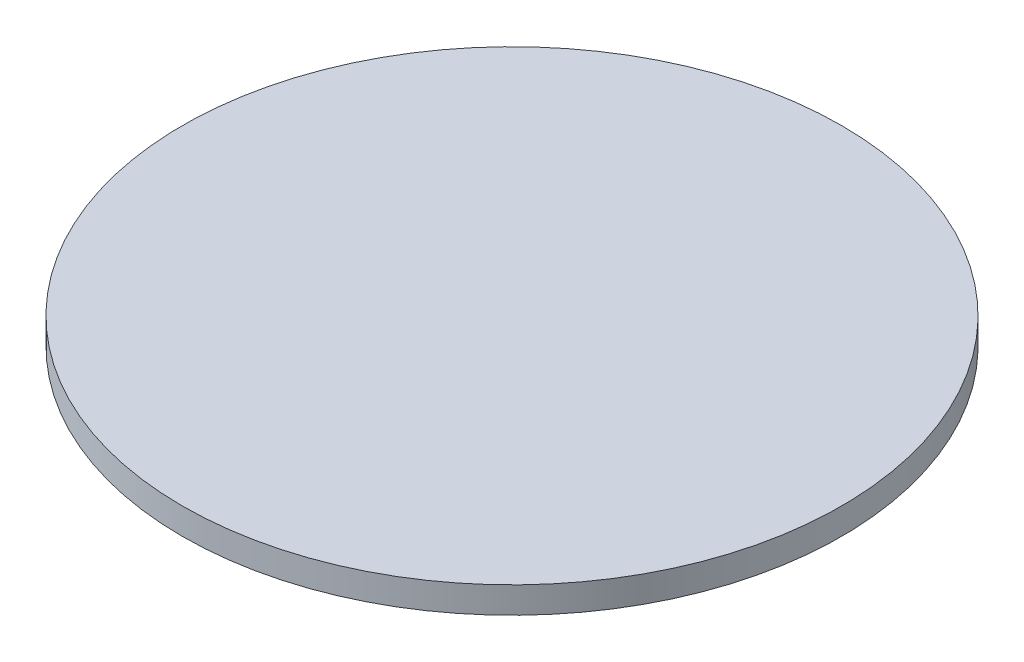
from build123d import *

# Parameters (mm, degrees)
SKETCH1_R           = 12.5
BOSS_EXTRUDE1_DEPTH = 1


with BuildPart() as part:
    # Sketch1 → Boss-Extrude1 (new body)
    with BuildSketch(Plane(origin=(0, 0, 0), x_dir=(1, 0, 0), z_dir=(0, 1, 0))):
        Circle(SKETCH1_R)
    extrude(amount=BOSS_EXTRUDE1_DEPTH)


solid = part.part
